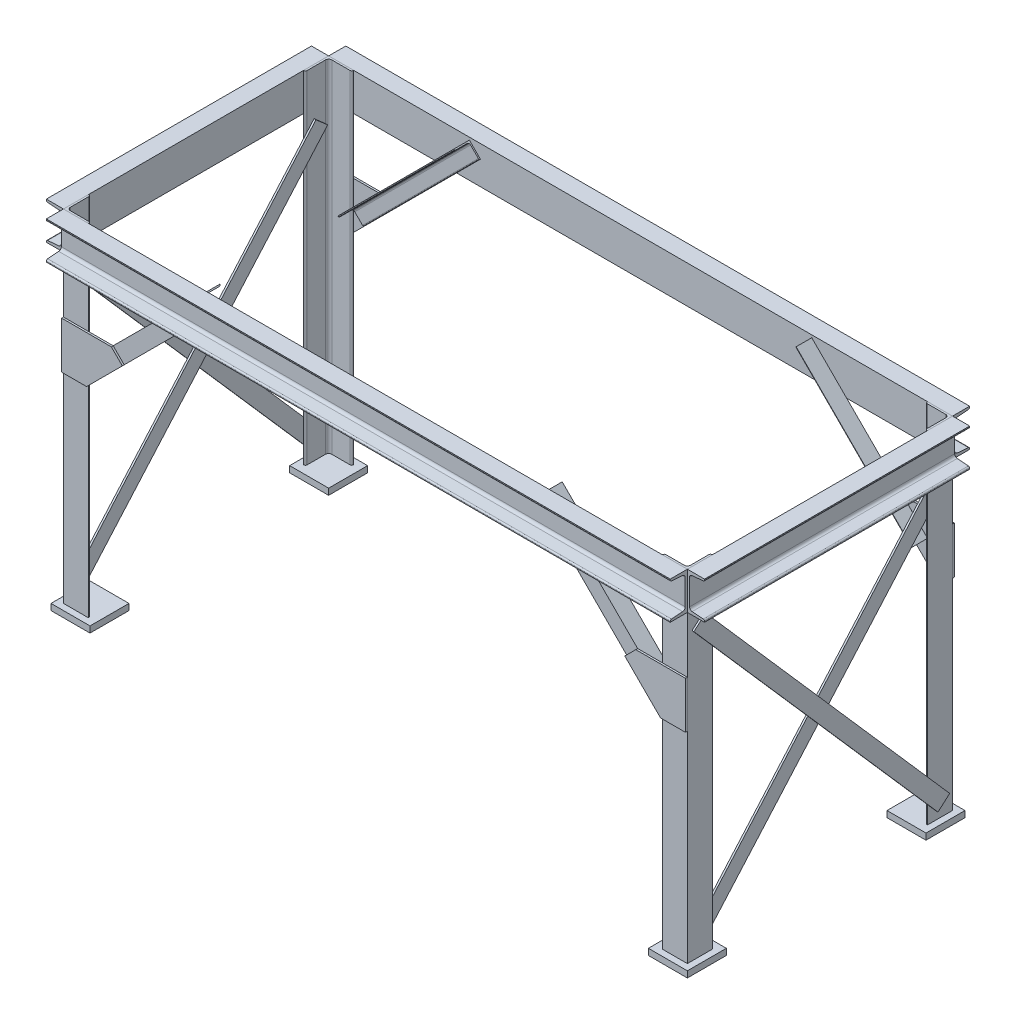
from build123d import *

# Parameters (mm, degrees)
SN_42_5570_U_U_120_1_DEPTH   = 850
SN_42_5570_U_U_120_1_2_DEPTH = 2000
SN_42_5570_U_U_120_1_3_DEPTH = 850
SN_42_5570_U_U_120_1_4_DEPTH = 2000
SN_42_5541_L_L_80X6_1_DEPTH  = 975
BODY_5_RUN_ON_DEPTH          = 120
Z_KLADN_PLECH1_DEPTH         = 6
SN_42_5541_L_L_50X4_1_DEPTH  = 525
SKICA13_W                    = 125
SKICA13_H                    = 125
Z_KLADN_PLECH2_DEPTH         = 20
P_IDAT_VYSUNUT_M1_DEPTH      = 6


# Sheet-metal steps are written as plain solids
with BuildPart() as part:
    # Sketch11 → Čsn 42 5570 - u U 120(1) (new body)
    with BuildSketch(Plane(origin=(1000, 0, -425), x_dir=(1, 0, 0), z_dir=(0, 0, 1))):
        with BuildLine():
            Line((55, 120), (0, 120))
            Line((0, 120), (0, 0))
            Line((0, 0), (55, 0))
            Line((55, 0), (55, 2.645602952))
            ThreePointArc((55, 2.645602952), (53.806422382, 5.698072613), (50.858857319, 7.1312714))
            Line((50.858857319, 7.1312714), (15.282285361, 9.977427639))
            ThreePointArc((15.282285361, 9.977427639), (9.387155236, 12.843825213), (7, 18.948764535))
            Line((7, 18.948764535), (7, 101.051235465))
            ThreePointArc((7, 101.051235465), (9.387155236, 107.156174787), (15.282285361, 110.022572361))
            Line((15.282285361, 110.022572361), (50.858857319, 112.8687286))
            ThreePointArc((50.858857319, 112.8687286), (53.806422382, 114.301927387), (55, 117.354397048))
            Line((55, 117.354397048), (55, 120))
        make_face()
    extrude(amount=SN_42_5570_U_U_120_1_DEPTH)


with BuildPart() as body_2:
    # Sketch11 on segment 2 (carried to segment 2) → sn 42 5570 - u U 120_1 2 (new body)
    with BuildSketch(Plane(origin=(1000, 0, 425), x_dir=(0, 0, 1), z_dir=(-1, 0, 0))):
        with BuildLine():
            Line((55, 120), (0, 120))
            Line((0, 120), (0, 0))
            Line((0, 0), (55, 0))
            Line((55, 0), (55, 2.645602952))
            ThreePointArc((55, 2.645602952), (53.806422382, 5.698072613), (50.858857319, 7.1312714))
            Line((50.858857319, 7.1312714), (15.282285361, 9.977427639))
            ThreePointArc((15.282285361, 9.977427639), (9.387155236, 12.843825213), (7, 18.948764535))
            Line((7, 18.948764535), (7, 101.051235465))
            ThreePointArc((7, 101.051235465), (9.387155236, 107.156174787), (15.282285361, 110.022572361))
            Line((15.282285361, 110.022572361), (50.858857319, 112.8687286))
            ThreePointArc((50.858857319, 112.8687286), (53.806422382, 114.301927387), (55, 117.354397048))
            Line((55, 117.354397048), (55, 120))
        make_face()
    extrude(amount=SN_42_5570_U_U_120_1_2_DEPTH)


with BuildPart() as body_3:
    # Sketch11 on segment 3 (carried to segment 3) → sn 42 5570 - u U 120_1 3 (new body)
    with BuildSketch(Plane(origin=(-1000, 0, 425), x_dir=(-1, 0, 0), z_dir=(0, 0, -1))):
        with BuildLine():
            Line((55, 120), (0, 120))
            Line((0, 120), (0, 0))
            Line((0, 0), (55, 0))
            Line((55, 0), (55, 2.645602952))
            ThreePointArc((55, 2.645602952), (53.806422382, 5.698072613), (50.858857319, 7.1312714))
            Line((50.858857319, 7.1312714), (15.282285361, 9.977427639))
            ThreePointArc((15.282285361, 9.977427639), (9.387155236, 12.843825213), (7, 18.948764535))
            Line((7, 18.948764535), (7, 101.051235465))
            ThreePointArc((7, 101.051235465), (9.387155236, 107.156174787), (15.282285361, 110.022572361))
            Line((15.282285361, 110.022572361), (50.858857319, 112.8687286))
            ThreePointArc((50.858857319, 112.8687286), (53.806422382, 114.301927387), (55, 117.354397048))
            Line((55, 117.354397048), (55, 120))
        make_face()
    extrude(amount=SN_42_5570_U_U_120_1_3_DEPTH)


with BuildPart() as body_4:
    # Sketch11 on segment 4 (carried to segment 4) → sn 42 5570 - u U 120_1 4 (new body)
    with BuildSketch(Plane(origin=(-1000, 0, -425), x_dir=(0, 0, -1), z_dir=(1, 0, 0))):
        with BuildLine():
            Line((55, 120), (0, 120))
            Line((0, 120), (0, 0))
            Line((0, 0), (55, 0))
            Line((55, 0), (55, 2.645602952))
            ThreePointArc((55, 2.645602952), (53.806422382, 5.698072613), (50.858857319, 7.1312714))
            Line((50.858857319, 7.1312714), (15.282285361, 9.977427639))
            ThreePointArc((15.282285361, 9.977427639), (9.387155236, 12.843825213), (7, 18.948764535))
            Line((7, 18.948764535), (7, 101.051235465))
            ThreePointArc((7, 101.051235465), (9.387155236, 107.156174787), (15.282285361, 110.022572361))
            Line((15.282285361, 110.022572361), (50.858857319, 112.8687286))
            ThreePointArc((50.858857319, 112.8687286), (53.806422382, 114.301927387), (55, 117.354397048))
            Line((55, 117.354397048), (55, 120))
        make_face()
    extrude(amount=SN_42_5570_U_U_120_1_4_DEPTH)


with BuildPart() as body_5:
    # Sketch1 → Čsn 42 5541 - l L  80X6(1) (new body)
    with BuildSketch(Plane(origin=(1000, 0, -425), x_dir=(0, 0, 1), z_dir=(0, -1, 0))):
        with BuildLine():
            Line((0, 0), (0, 80))
            Line((0, 80), (1, 80))
            ThreePointArc((1, 80), (4.535533906, 78.535533906), (6, 75))
            Line((6, 75), (6, 16))
            ThreePointArc((6, 16), (8.928932188, 8.928932188), (16, 6))
            Line((16, 6), (75, 6))
            ThreePointArc((75, 6), (78.535533906, 4.535533906), (80, 1))
            Line((80, 1), (80, 0))
            Line((80, 0), (0, 0))
        make_face()
    extrude(amount=SN_42_5541_L_L_80X6_1_DEPTH)

    # Sketch1 → body 5 run on (add)
    with BuildSketch(Plane(origin=(1000, 0, -425), x_dir=(0, 0, 1), z_dir=(0, -1, 0))):
        with BuildLine():
            Line((0, 0), (0, 80))
            Line((0, 80), (1, 80))
            ThreePointArc((1, 80), (4.535533906, 78.535533906), (6, 75))
            Line((6, 75), (6, 16))
            ThreePointArc((6, 16), (8.928932188, 8.928932188), (16, 6))
            Line((16, 6), (75, 6))
            ThreePointArc((75, 6), (78.535533906, 4.535533906), (80, 1))
            Line((80, 1), (80, 0))
            Line((80, 0), (0, 0))
        make_face()
    extrude(amount=-BODY_5_RUN_ON_DEPTH)


with BuildPart() as body_6:
    # Skica5 → Základní plech1 (new body)
    with BuildSketch(Plane(origin=(0, 0, -425), x_dir=(-1, 0, 0), z_dir=(0, 0, -1))):
        Polygon((-1000, -180), (-1000, -330), (-920, -330), (-805.355339059, -215.355339059), (-840.710678119, -180), align=None)
    extrude(amount=Z_KLADN_PLECH1_DEPTH)


with BuildPart() as body_7:
    # Sketch13 → Čsn 42 5541 - l L  50X4(1) (new body)
    with BuildSketch(Plane(origin=(920, -259.289321881, -425), x_dir=(-0.7071067811865476, -0.7071067811865476, 4.449175649009083e-15), z_dir=(-0.7071067811865476, 0.7071067811865476, -2.372751904709617e-15))):
        with BuildLine():
            Line((0, 0), (0, 50))
            Line((0, 50), (0.5, 50))
            ThreePointArc((0.5, 50), (2.974873734, 48.974873734), (4, 46.5))
            Line((4, 46.5), (4, 11))
            ThreePointArc((4, 11), (6.050252532, 6.050252532), (11, 4))
            Line((11, 4), (46.5, 4))
            ThreePointArc((46.5, 4), (48.974873734, 2.974873734), (50, 0.5))
            Line((50, 0.5), (50, 0))
            Line((50, 0), (0, 0))
        make_face()
    extrude(amount=SN_42_5541_L_L_50X4_1_DEPTH)


with BuildPart() as body_8:
    # Skica13 → Základní plech2 (new body)
    with BuildSketch(Plane.XZ.offset(975)):
        with Locations((957.5, -382.5)):
            Rectangle(SKICA13_W, SKICA13_H)
    extrude(amount=Z_KLADN_PLECH2_DEPTH)


with BuildPart() as body_9:
    # Zrcadlit1: mirrored copy
    add(body_7.part.mirror(Plane.XY))


with BuildPart() as body_10:
    # Zrcadlit1 2: mirrored copy
    add(body_5.part.mirror(Plane.XY))


with BuildPart() as body_11:
    # Zrcadlit2: mirrored copy
    add(body_8.part.mirror(Plane.XY))


with BuildPart() as body_12:
    # Zrcadlit2 2: mirrored copy
    add(body_6.part.mirror(Plane.XY))


with BuildPart() as body_13:
    # Skica21 → Přidat vysunutím1 (new body)
    with BuildSketch(Plane(origin=(1000, 0, 0), x_dir=(0, 0, -1), z_dir=(1, 0, 0))):
        Polygon((410, -917.029817839), (372.410545518, -950), (-410, -57.970182161), (-372.410545518, -25), align=None)
    extrude(amount=P_IDAT_VYSUNUT_M1_DEPTH)


with BuildPart() as body_14:
    # Zrcadlit4: mirrored copy
    add(body_13.part.mirror(Plane.XY))


with BuildPart() as body_14_1:
    # Tělo-Přesunout/kopírovat1: moved
    add(body_14.part.moved(Location((-12, 0, 0))))


with BuildPart() as body_15:
    # Zrcadlit5: mirrored copy
    add(body_5.part.mirror(Plane(origin=(0, 0, 0), x_dir=(0, 0, 1), z_dir=(1, 0, 0))))


with BuildPart() as body_16:
    # Zrcadlit5 2: mirrored copy
    add(body_10.part.mirror(Plane(origin=(0, 0, 0), x_dir=(0, 0, 1), z_dir=(1, 0, 0))))


with BuildPart() as body_17:
    # Zrcadlit5 3: mirrored copy
    add(body_9.part.mirror(Plane(origin=(0, 0, 0), x_dir=(0, 0, 1), z_dir=(1, 0, 0))))


with BuildPart() as body_18:
    # Zrcadlit5 4: mirrored copy
    add(body_7.part.mirror(Plane(origin=(0, 0, 0), x_dir=(0, 0, 1), z_dir=(1, 0, 0))))


with BuildPart() as body_19:
    # Zrcadlit5 5: mirrored copy
    add(body_14_1.part.mirror(Plane(origin=(0, 0, 0), x_dir=(0, 0, 1), z_dir=(1, 0, 0))))


with BuildPart() as body_20:
    # Zrcadlit5 6: mirrored copy
    add(body_13.part.mirror(Plane(origin=(0, 0, 0), x_dir=(0, 0, 1), z_dir=(1, 0, 0))))


with BuildPart() as body_21:
    # Zrcadlit6: mirrored copy
    add(body_6.part.mirror(Plane(origin=(0, 0, 0), x_dir=(0, 0, 1), z_dir=(1, 0, 0))))


with BuildPart() as body_22:
    # Zrcadlit6 2: mirrored copy
    add(body_12.part.mirror(Plane(origin=(0, 0, 0), x_dir=(0, 0, 1), z_dir=(1, 0, 0))))


with BuildPart() as body_23:
    # Zrcadlit6 3: mirrored copy
    add(body_8.part.mirror(Plane(origin=(0, 0, 0), x_dir=(0, 0, 1), z_dir=(1, 0, 0))))


with BuildPart() as body_24:
    # Zrcadlit6 4: mirrored copy
    add(body_11.part.mirror(Plane(origin=(0, 0, 0), x_dir=(0, 0, 1), z_dir=(1, 0, 0))))


solid = Compound([part.part, body_2.part, body_3.part, body_4.part, body_5.part, body_6.part, body_7.part, body_8.part, body_9.part, body_10.part, body_11.part, body_12.part, body_13.part, body_14_1.part, body_15.part, body_16.part, body_17.part, body_18.part, body_19.part, body_20.part, body_21.part, body_22.part, body_23.part, body_24.part])
